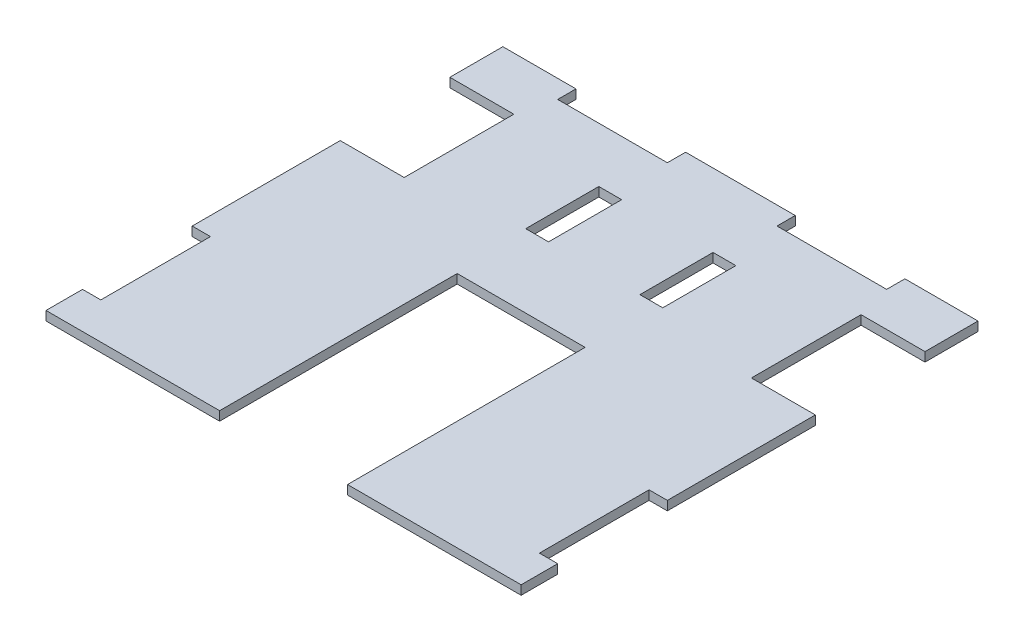
from build123d import *

# Parameters (mm, degrees)
BOSS_EXTRUDE1_DEPTH = 6.35
SKETCH2_W           = 44.45
SKETCH2_H           = 76.2
SKETCH2_W_2         = 12.7
SKETCH2_W_3         = 76.2
SKETCH2_H_2         = 12.7
CUT_EXTRUDE1_DEPTH  = 293.444905068
SKETCH3_W           = 15.875
SKETCH3_H           = 50.8
CUT_EXTRUDE2_DEPTH  = 293.444905068


with BuildPart() as part:
    # Sketch1 → Boss-Extrude1 (new body)
    with BuildSketch(Plane(origin=(0, 0, 0), x_dir=(1, 0, 0), z_dir=(0, 1, 0))):
        Polygon((-165.1, 76.2), (-165.1, -241.3), (-44.45, -241.3), (-44.45, -76.2), (44.45, -76.2), (44.45, -241.3), (165.1, -241.3), (165.1, 76.2), align=None)
    extrude(amount=BOSS_EXTRUDE1_DEPTH)

    # Sketch2 → Cut-Extrude1 (cut, through all)
    with BuildSketch(Plane(origin=(0, 6.35, 0), x_dir=(1, 0, 0), z_dir=(0, 1, 0))):
        with Locations((142.875, 1.27)):
            Rectangle(SKETCH2_W, SKETCH2_H)
        with Locations((158.75, -177.8)):
            Rectangle(SKETCH2_W_2, SKETCH2_H)
        with Locations((-158.75, -177.8)):
            Rectangle(SKETCH2_W_2, SKETCH2_H)
        with Locations((-142.875, 1.27)):
            Rectangle(SKETCH2_W, SKETCH2_H)
        with Locations((-76.2, 69.85)):
            Rectangle(SKETCH2_W_3, SKETCH2_H_2)
        with Locations((76.2, 69.85)):
            Rectangle(SKETCH2_W_3, SKETCH2_H_2)
    extrude(amount=-CUT_EXTRUDE1_DEPTH, mode=Mode.SUBTRACT)

    # Sketch3 → Cut-Extrude2 (cut, through all)
    with BuildSketch(Plane(origin=(0, 6.35, 0), x_dir=(1, 0, 0), z_dir=(0, 1, 0))):
        with Locations((-39.6875, 0)):
            Rectangle(SKETCH3_W, SKETCH3_H)
        with Locations((39.6875, 0)):
            Rectangle(SKETCH3_W, SKETCH3_H)
    extrude(amount=-CUT_EXTRUDE2_DEPTH, mode=Mode.SUBTRACT)


solid = part.part
